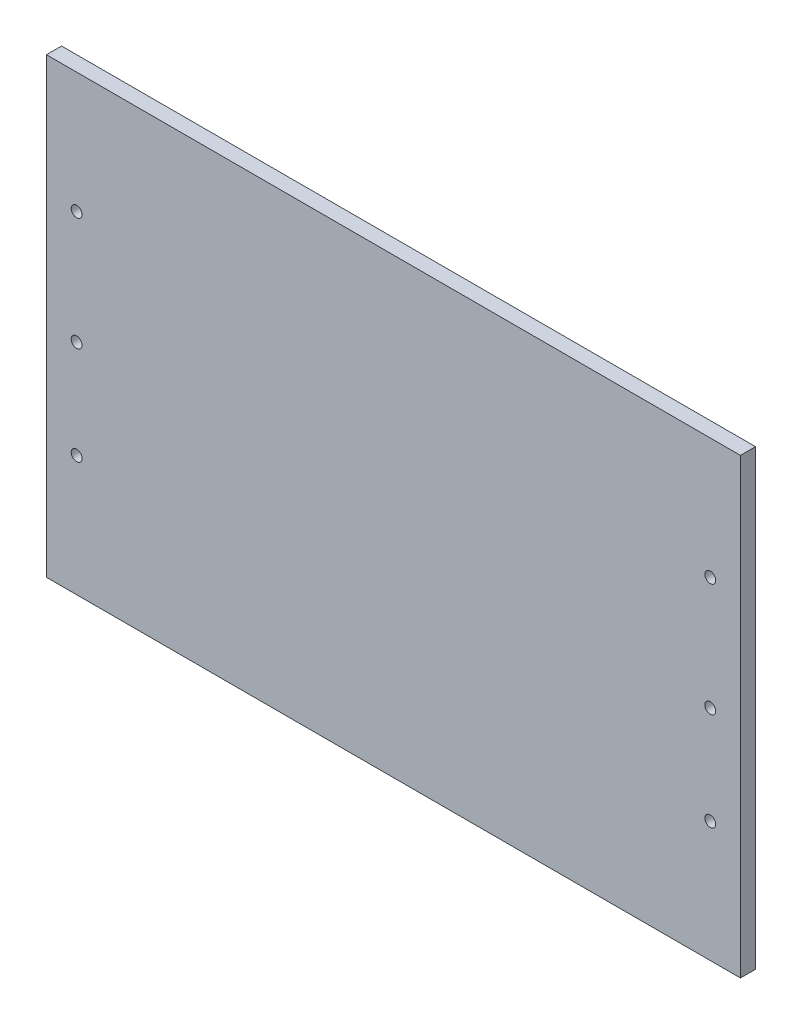
from build123d import *

# Parameters (mm, degrees)
SZKIC1_W                                          = 230
SZKIC1_H                                          = 150
DODANIE_WYCI_GNI_CIE1_DEPTH                       = 5
POG_BIENIE_WALCOWE_POD_M3_RUB_Z_BEM_S_D           = 3.6
POG_BIENIE_WALCOWE_POD_M3_RUB_Z_BEM_S_DEPTH       = 6.7
POG_BIENIE_WALCOWE_POD_M3_RUB_Z_BEM_S_CBORE_D     = 7
POG_BIENIE_WALCOWE_POD_M3_RUB_Z_BEM_S_CBORE_DEPTH = 2.4
POG_BIENIE_WALCOWE_POD_M3_RUB_Z_BEM_S_TIP         = 1.081549114


with BuildPart() as part:
    # Szkic1 → Dodanie-wyciągnięcie1 (new body)
    with BuildSketch(Plane.XY):
        Rectangle(SZKIC1_W, SZKIC1_H)
    extrude(amount=DODANIE_WYCI_GNI_CIE1_DEPTH)

    # Pogłębienie walcowe pod M3 Śrubę z łbem stożkowym ściętym1
    with Locations(Plane(origin=(0, 0, 0), x_dir=(-1, 0, 0), z_dir=(0, 0, -1))):
        with Locations((-105, -35), (105, -35), (105, -2.5), (105, 35), (-105, 35), (-105, -2.5)):
            CounterBoreHole(POG_BIENIE_WALCOWE_POD_M3_RUB_Z_BEM_S_D / 2, POG_BIENIE_WALCOWE_POD_M3_RUB_Z_BEM_S_CBORE_D / 2, POG_BIENIE_WALCOWE_POD_M3_RUB_Z_BEM_S_CBORE_DEPTH, depth=POG_BIENIE_WALCOWE_POD_M3_RUB_Z_BEM_S_DEPTH)
            with Locations((0, 0, -(POG_BIENIE_WALCOWE_POD_M3_RUB_Z_BEM_S_DEPTH + POG_BIENIE_WALCOWE_POD_M3_RUB_Z_BEM_S_TIP / 2))):  # 118° drill point
                Cone(0, POG_BIENIE_WALCOWE_POD_M3_RUB_Z_BEM_S_D / 2, POG_BIENIE_WALCOWE_POD_M3_RUB_Z_BEM_S_TIP, mode=Mode.SUBTRACT)


solid = part.part
